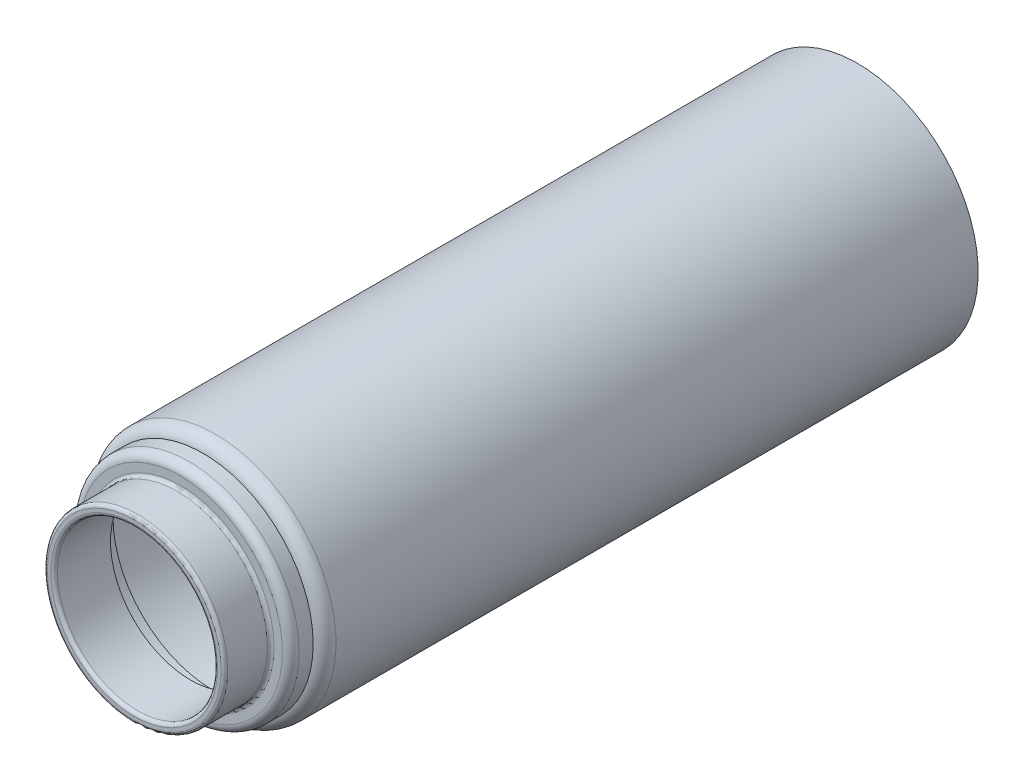
from build123d import *

# Parameters (mm, degrees)
SKETCH1_R           = 36.40455
BOSS_EXTRUDE1_DEPTH = 197.64375
SKETCH2_R           = 33.274
BOSS_EXTRUDE2_DEPTH = 6.7818
SKETCH3_R           = 27.2288
BOSS_EXTRUDE3_DEPTH = 13.97
SHELL1_T            = -3.048
FILLET1_R           = 3.81
FILLET2_R           = 2.54
FILLET3_R           = 1
FILLET4_R           = 1.000000032


with BuildPart() as part:
    # Sketch1 → Boss-Extrude1 (new body)
    with BuildSketch(Plane.XY):
        with Locations(Location((0, 0, 0), (0, 0, 180))):
            Circle(SKETCH1_R)
    extrude(amount=BOSS_EXTRUDE1_DEPTH)

    # Sketch2 → Boss-Extrude2 (add)
    with BuildSketch(Plane.XY.offset(197.64375)):
        with Locations(Location((0, 0, 0), (0, 0, 180))):
            Circle(SKETCH2_R)
    extrude(amount=BOSS_EXTRUDE2_DEPTH)

    # Sketch3 → Boss-Extrude3 (add)
    with BuildSketch(Plane.XY.offset(204.42555)):
        Circle(SKETCH3_R)
    extrude(amount=BOSS_EXTRUDE3_DEPTH)

    # Shell1
    shell1_openings = [part.faces().sort_by_distance(p)[0] for p in [
        (0, 0, 218.39555),
    ]]
    offset(amount=SHELL1_T, openings=shell1_openings, kind=Kind.INTERSECTION)

    # Fillet1
    # the kernel refuses this fillet: 3.81 mm, written as the material it takes off along each edge
    with BuildSketch(Plane(origin=(0, 0, 197.64375), x_dir=(-1, 0, 0), z_dir=(0, 1, 0))) as fillet1_piece_1:
        with BuildLine():
            CenterArc((32.59455, -3.748926206), FILLET1_R, 0, 79.727303784)
            Line((33.274, 0), (33.287589, 0.074978524))
            ThreePointArc((33.287589, 0.074978524), (34.839275, 0.0762), (36.40455, 0.0762))
            Line((36.40455, 0.0762), (36.48075, 0))
            Line((36.48075, 0), (36.48075, -3.748926206))
            Line((36.48075, -3.748926206), (36.40455, -3.748926206))
        make_face()
    revolve(axis=Axis((0, 0, 197.64375), (0, 0, 1)), mode=Mode.SUBTRACT)

    # Fillet2
    fillet2_edges = [part.edges().sort_by_distance(p)[0] for p in [
        (33.274, 0, 204.42555),
    ]]
    fillet(fillet2_edges, radius=FILLET2_R)

    # Fillet3
    fillet3_edges = [part.edges().sort_by_distance(p)[0] for p in [
        (-27.2288, 0, 204.42555),
    ]]
    fillet(fillet3_edges, radius=FILLET3_R)

    # Fillet4
    fillet4_edges = [part.edges().sort_by_distance(p)[0] for p in [
        (-27.2288, 0, 218.39555),
        (-24.1808, 0, 218.39555),
    ]]
    fillet(fillet4_edges, radius=FILLET4_R)


solid = part.part
